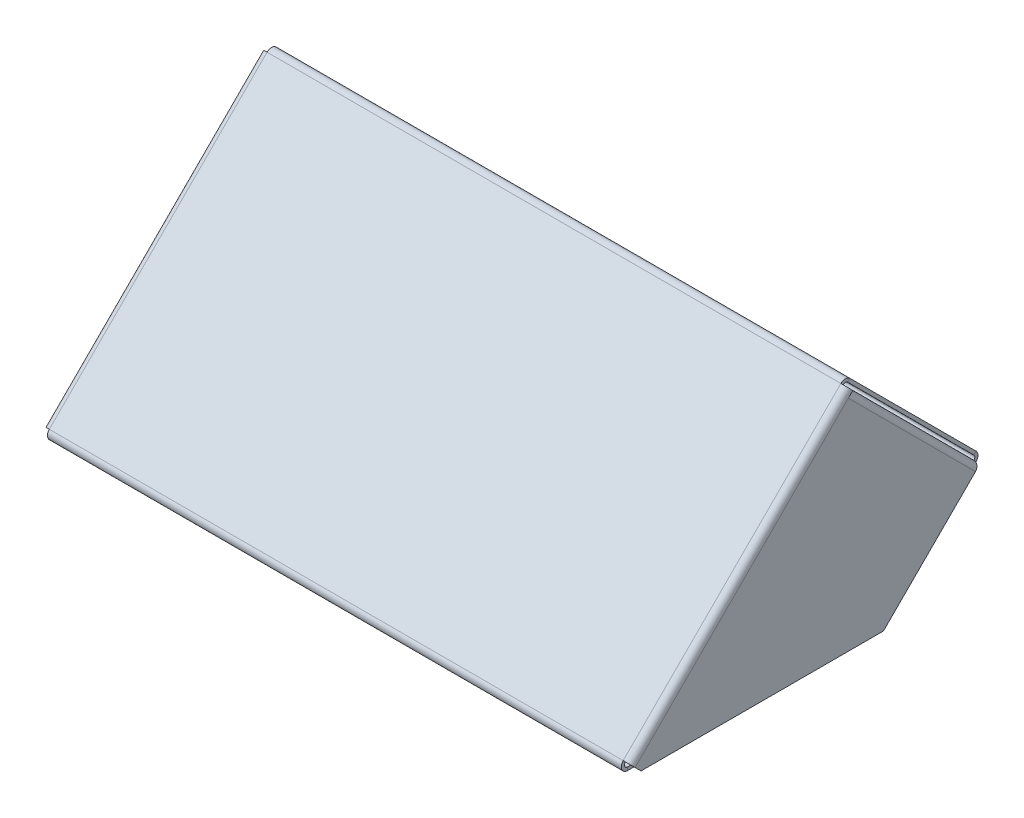
from build123d import *

# Parameters (mm, degrees)
SKETCH1_W                     = 90
SKETCH1_H                     = 40
BASE_FLANGE1_DEPTH            = 0.5
EDGE_FLANGE1_STRIP_CUT_DEPTH  = 90
EDGE_FLANGE1_DEPTH            = 90
EDGE_FLANGE3_STRIP_CUT_DEPTH  = 90
EDGE_FLANGE3_DEPTH            = 90
EDGE_FLANGE2_STRIP_W          = 3
EDGE_FLANGE2_STRIP_H          = 0.5
EDGE_FLANGE2_STRIP_CUT_DEPTH  = 90
EDGE_FLANGE2_DEPTH            = 90
EDGE_FLANGE5_STRIP_W          = 3
EDGE_FLANGE5_STRIP_H          = 0.5
EDGE_FLANGE5_STRIP_CUT_DEPTH  = 90
EDGE_FLANGE5_DEPTH            = 90
EDGE_FLANGE7_DEPTH            = 48.292893219
EDGE_FLANGE8_DEPTH            = 48.292893219
CUT_EXTRUDE3_DEPTH            = 106.168160415
EDGE_FLANGE9_STRIP_W          = 3
EDGE_FLANGE9_STRIP_H          = 0.5
EDGE_FLANGE9_STRIP_CUT_DEPTH  = 28.3
EDGE_FLANGE9_DEPTH            = 28.3
EDGE_FLANGE10_STRIP_W         = 3
EDGE_FLANGE10_STRIP_H         = 0.5
EDGE_FLANGE10_STRIP_CUT_DEPTH = 28.2
EDGE_FLANGE10_DEPTH           = 28.2
SKETCH65_R                    = 1.5
CUT_EXTRUDE4_DEPTH            = 5


# Sheet-metal steps are written as plain solids
with BuildPart() as part:
    # Sketch1 → Base-Flange1 (new body)
    with BuildSketch(Plane(origin=(0, 0, 0), x_dir=(1, 0, 0), z_dir=(0, 1, 0))):
        Rectangle(SKETCH1_W, SKETCH1_H)
    extrude(amount=-BASE_FLANGE1_DEPTH)

    # Edge-Flange1 strip (across the edge) → Edge-Flange1 strip cut (cut)
    with BuildSketch(Plane(origin=(-45, 0, 20), x_dir=(0, -0.7071067811865513, -0.7071067811865438), z_dir=(1, 0, 0))):
        Polygon((-3.914213562, -4.621320344), (1.207106781, 0.5), (0.853553391, 0.853553391), (-4.267766953, -4.267766953), align=None)
    extrude(amount=EDGE_FLANGE1_STRIP_CUT_DEPTH, mode=Mode.SUBTRACT)

    # Edge-Flange1 section (across the edge) → Edge-Flange1 (add)
    with BuildSketch(Plane(origin=(-45, 0, 20), x_dir=(0, -0.7071067811865513, -0.7071067811865438), z_dir=(1, 0, 0))):
        with BuildLine():
            Line((-0.5, 1.207106781), (-0.5, 50))
            Line((-0.5, 50), (0, 50))
            Line((0, 50), (0, 1.207106781))
            ThreePointArc((0, 1.207106781), (0.308658284, 0.745167015), (0.853553391, 0.853553391))
            Line((0.853553391, 0.853553391), (1.207106781, 0.5))
            ThreePointArc((1.207106781, 0.5), (0.117316568, 0.283227249), (-0.5, 1.207106781))
        make_face()
    extrude(amount=EDGE_FLANGE1_DEPTH)

    # Edge-Flange3 strip (across the edge) → Edge-Flange3 strip cut (cut)
    with BuildSketch(Plane(origin=(45, 0, -20), x_dir=(0, 0.7071067811865562, 0.7071067811865388), z_dir=(-1, 0, 0))):
        Polygon((-2.328427125, 1.621320344), (-0.207106781, -0.5), (0.146446609, -0.146446609), (-1.974873734, 1.974873734), align=None)
    extrude(amount=EDGE_FLANGE3_STRIP_CUT_DEPTH, mode=Mode.SUBTRACT)

    # Edge-Flange3 section (across the edge) → Edge-Flange3 (add)
    with BuildSketch(Plane(origin=(45, 0, -20), x_dir=(0, 0.7071067811865562, 0.7071067811865388), z_dir=(-1, 0, 0))):
        with BuildLine():
            Line((-0.5, 0.207106781), (-0.5, 10))
            Line((-0.5, 10), (0, 10))
            Line((0, 10), (0, 0.207106781))
            ThreePointArc((0, 0.207106781), (0.038060234, 0.015765065), (0.146446609, -0.146446609))
            Line((0.146446609, -0.146446609), (-0.207106781, -0.5))
            ThreePointArc((-0.207106781, -0.5), (-0.423879533, -0.175576651), (-0.5, 0.207106781))
        make_face()
    extrude(amount=EDGE_FLANGE3_DEPTH)

    # Edge-Flange2 strip (across the edge) → Edge-Flange2 strip cut (cut)
    with BuildSketch(Plane(origin=(-45, 35.355339059, -15.355339059), x_dir=(0, -0.7071067811865511, 0.7071067811865439), z_dir=(1, 0, 0))):
        with Locations((-1, -0.25)):
            Rectangle(EDGE_FLANGE2_STRIP_W, EDGE_FLANGE2_STRIP_H)
    extrude(amount=EDGE_FLANGE2_STRIP_CUT_DEPTH, mode=Mode.SUBTRACT)

    # Edge-Flange2 section (across the edge) → Edge-Flange2 (add)
    with BuildSketch(Plane(origin=(-45, 35.355339059, -15.355339059), x_dir=(0, -0.7071067811865511, 0.7071067811865439), z_dir=(1, 0, 0))):
        with BuildLine():
            Line((-0.5, 0.5), (-0.5, 29))
            Line((-0.5, 29), (0, 29))
            Line((0, 29), (0, 0.5))
            ThreePointArc((0, 0.5), (0.146446609, 0.146446609), (0.5, 0))
            Line((0.5, 0), (0.5, -0.5))
            ThreePointArc((0.5, -0.5), (-0.207106781, -0.207106781), (-0.5, 0.5))
        make_face()
    extrude(amount=EDGE_FLANGE2_DEPTH)

    # Edge-Flange5 strip (across the edge) → Edge-Flange5 strip cut (cut)
    with BuildSketch(Plane(origin=(-45, 14.849242405, -35.861435714), x_dir=(0, 0.7071067811865416, 0.7071067811865535), z_dir=(1, 0, 0))):
        with Locations((-1, -0.25)):
            Rectangle(EDGE_FLANGE5_STRIP_W, EDGE_FLANGE5_STRIP_H)
    extrude(amount=EDGE_FLANGE5_STRIP_CUT_DEPTH, mode=Mode.SUBTRACT)

    # Edge-Flange5 section (across the edge) → Edge-Flange5 (add)
    with BuildSketch(Plane(origin=(-45, 14.849242405, -35.861435714), x_dir=(0, 0.7071067811865416, 0.7071067811865535), z_dir=(1, 0, 0))):
        with BuildLine():
            Line((-0.5, 0.5), (-0.5, 21))
            Line((-0.5, 21), (0, 21))
            Line((0, 21), (0, 0.5))
            ThreePointArc((0, 0.5), (0.146446609, 0.146446609), (0.5, 0))
            Line((0.5, 0), (0.5, -0.5))
            ThreePointArc((0.5, -0.5), (-0.207106781, -0.207106781), (-0.5, 0.5))
        make_face()
    extrude(amount=EDGE_FLANGE5_DEPTH)

    # Edge-Flange7 section (across the edge) → Edge-Flange7 (add)
    with BuildSketch(Plane(origin=(-45.5, 0.853553391, 19.146446609), x_dir=(1, 0, 0), z_dir=(0, 0.707106781186544, -0.7071067811865512))):
        with BuildLine():
            Line((-0.5, 0.5), (-0.5, 28.8))
            Line((-0.5, 28.8), (0, 28.8))
            Line((0, 28.8), (0, 0.5))
            ThreePointArc((0, 0.5), (0.146446609, 0.146446609), (0.5, 0))
            Line((0.5, 0), (0.5, -0.5))
            ThreePointArc((0.5, -0.5), (-0.207106781, -0.207106781), (-0.5, 0.5))
        make_face()
    extrude(amount=EDGE_FLANGE7_DEPTH)

    # Edge-Flange8 section (across the edge) → Edge-Flange8 (add)
    with BuildSketch(Plane(origin=(45.6, 35.001785669, -15.001785669), x_dir=(-1, 0, 0), z_dir=(0, -0.7071067811865439, 0.7071067811865512))):
        with BuildLine():
            Line((-0.5, 0.6), (-0.5, 28.8))
            Line((-0.5, 28.8), (0, 28.8))
            Line((0, 28.8), (0, 0.6))
            ThreePointArc((0, 0.6), (0.175735931, 0.175735931), (0.6, 0))
            Line((0.6, 0), (0.6, -0.5))
            ThreePointArc((0.6, -0.5), (-0.177817459, -0.177817459), (-0.5, 0.6))
        make_face()
    extrude(amount=EDGE_FLANGE8_DEPTH)

    # Sketch52 → Cut-Extrude3 (cut, through all)
    with BuildSketch(Plane.ZY.offset(46)):
        Polygon((-20.229350596, -0.5), (17.792893219, -0.5), (-1.218228689, -19.511121908), align=None)
    extrude(amount=-CUT_EXTRUDE3_DEPTH, mode=Mode.SUBTRACT)

    # Edge-Flange9 strip (across the edge) → Edge-Flange9 strip cut (cut)
    with BuildSketch(Plane(origin=(-45.5, 14.637110371, -35.366460967), x_dir=(3.347797797820495e-15, -0.7071067811865438, 0.7071067811865515), z_dir=(0, 0.7071067811865515, 0.7071067811865438))):
        with Locations((-0.5, -0.25)):
            Rectangle(EDGE_FLANGE9_STRIP_W, EDGE_FLANGE9_STRIP_H)
    extrude(amount=EDGE_FLANGE9_STRIP_CUT_DEPTH, mode=Mode.SUBTRACT)

    # Edge-Flange9 section (across the edge) → Edge-Flange9 (add)
    with BuildSketch(Plane(origin=(-45.5, 14.637110371, -35.366460967), x_dir=(3.347797797820495e-15, -0.7071067811865438, 0.7071067811865515), z_dir=(0, 0.7071067811865515, 0.7071067811865438))):
        with BuildLine():
            Line((0, 0.5), (0, 10))
            Line((0, 10), (0.5, 10))
            Line((0.5, 10), (0.5, 0.5))
            ThreePointArc((0.5, 0.5), (0.646446609, 0.146446609), (1, 0))
            Line((1, 0), (1, -0.5))
            ThreePointArc((1, -0.5), (0.292893219, -0.207106781), (0, 0.5))
        make_face()
    extrude(amount=EDGE_FLANGE9_DEPTH)

    # Edge-Flange10 strip (across the edge) → Edge-Flange10 strip cut (cut)
    with BuildSketch(Plane(origin=(45.6, 34.5775216, -15.426049737), x_dir=(-3.491481338843137e-15, -0.7071067811865434, 0.7071067811865518), z_dir=(3.4448409452021724e-15, -0.7071067811865518, -0.7071067811865434))):
        with Locations((-0.5, -0.25)):
            Rectangle(EDGE_FLANGE10_STRIP_W, EDGE_FLANGE10_STRIP_H)
    extrude(amount=EDGE_FLANGE10_STRIP_CUT_DEPTH, mode=Mode.SUBTRACT)

    # Edge-Flange10 section (across the edge) → Edge-Flange10 (add)
    with BuildSketch(Plane(origin=(45.6, 34.5775216, -15.426049737), x_dir=(-3.491481338843137e-15, -0.7071067811865434, 0.7071067811865518), z_dir=(3.4448409452021724e-15, -0.7071067811865518, -0.7071067811865434))):
        with BuildLine():
            Line((0, 0.5), (0, 10))
            Line((0, 10), (0.5, 10))
            Line((0.5, 10), (0.5, 0.5))
            ThreePointArc((0.5, 0.5), (0.646446609, 0.146446609), (1, 0))
            Line((1, 0), (1, -0.5))
            ThreePointArc((1, -0.5), (0.292893219, -0.207106781), (0, 0.5))
        make_face()
    extrude(amount=EDGE_FLANGE10_DEPTH)

    # Sketch65 → Cut-Extrude4 (cut)
    with BuildSketch(Plane.XZ.offset(0.5)):
        with Locations(Location((-41, 9.591937881, 0), (0, 0, 270))):
            Circle(SKETCH65_R)
        with Locations(Location((41, 9.591937881, 0), (0, 0, 90))):
            Circle(SKETCH65_R)
        with Locations(Location((-41, -12.92766953, 0), (0, 0, 270))):
            Circle(SKETCH65_R)
        with Locations(Location((41, -12.92766953, 0), (0, 0, 90))):
            Circle(SKETCH65_R)
    extrude(amount=-CUT_EXTRUDE4_DEPTH, mode=Mode.SUBTRACT)


solid = part.part
